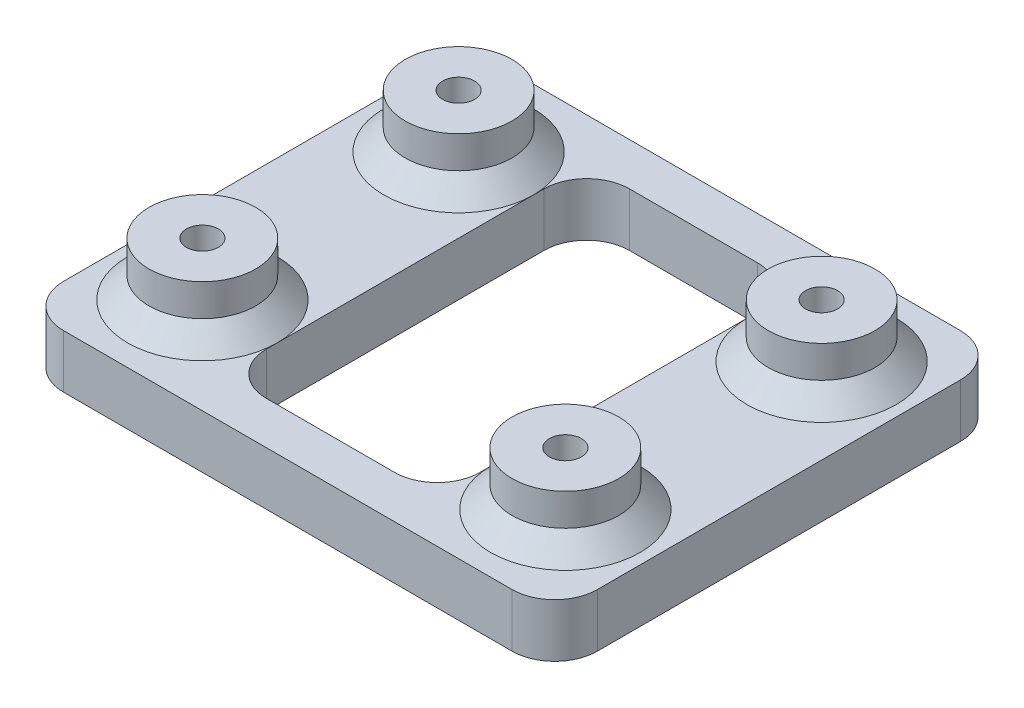
from build123d import *

# Parameters (mm, degrees)
SKETCH1_W           = 31.75
SKETCH1_H           = 26.67
BOSS_EXTRUDE1_DEPTH = 3.175
SKETCH2_R           = 0.95
CUT_EXTRUDE1_DEPTH  = 21.974233597
BOSS_EXTRUDE2_START = 3.175
SKETCH3_R           = 3.175
SKETCH3_R_2         = 0.95
BOSS_EXTRUDE2_DEPTH = 3.175
SKETCH4_W           = 12.7
SKETCH4_H           = 21.59
CUT_EXTRUDE2_DEPTH  = 21.974233597
FILLET1_R           = 2.54
CHAMFER1_SIZE       = 1.27


with BuildPart() as part:
    # Sketch1 → Boss-Extrude1 (new body)
    with BuildSketch(Plane(origin=(0, 0, 0), x_dir=(1, 0, 0), z_dir=(0, 1, 0))):
        Rectangle(SKETCH1_W, SKETCH1_H)
    extrude(amount=BOSS_EXTRUDE1_DEPTH)

    # Sketch2 → Cut-Extrude1 (cut, through all)
    with BuildSketch(Plane(origin=(0, 3.175, 0), x_dir=(1, 0, 0), z_dir=(0, 1, 0))):
        with Locations(Location((-10.795, 7.62, 0), (0, 0, 270))):
            Circle(SKETCH2_R)
        with Locations(Location((10.795, 7.62, 0), (0, 0, 270))):
            Circle(SKETCH2_R)
        with Locations(Location((10.795, -7.62, 0), (0, 0, 270))):
            Circle(SKETCH2_R)
        with Locations(Location((-10.795, -7.62, 0), (0, 0, 270))):
            Circle(SKETCH2_R)
    extrude(amount=-CUT_EXTRUDE1_DEPTH, mode=Mode.SUBTRACT)

    # Sketch3 → Boss-Extrude2 (add)
    # profile 1 of 4: a face of its own
    with BuildSketch(Plane(origin=(0, 3.175, 0), x_dir=(1, 0, 0), z_dir=(0, 1, 0)).offset(BOSS_EXTRUDE2_START)):
        with Locations(Location((-10.795, 7.62, 0), (0, 0, 90))):
            Circle(SKETCH3_R)
        with Locations(Location((-10.795, 7.62, 0), (0, 0, 270))):
            Circle(SKETCH3_R_2, mode=Mode.SUBTRACT)
    # profile 2 of 4: a face of its own
    with BuildSketch(Plane(origin=(0, 3.175, 0), x_dir=(1, 0, 0), z_dir=(0, 1, 0)).offset(BOSS_EXTRUDE2_START)):
        with Locations(Location((10.795, 7.62, 0), (0, 0, 90))):
            Circle(SKETCH3_R)
        with Locations(Location((10.795, 7.62, 0), (0, 0, 270))):
            Circle(SKETCH3_R_2, mode=Mode.SUBTRACT)
    # profile 3 of 4: a face of its own
    with BuildSketch(Plane(origin=(0, 3.175, 0), x_dir=(1, 0, 0), z_dir=(0, 1, 0)).offset(BOSS_EXTRUDE2_START)):
        with Locations(Location((10.795, -7.62, 0), (0, 0, 90))):
            Circle(SKETCH3_R)
        with Locations(Location((10.795, -7.62, 0), (0, 0, 270))):
            Circle(SKETCH3_R_2, mode=Mode.SUBTRACT)
    # profile 4 of 4: a face of its own
    with BuildSketch(Plane(origin=(0, 3.175, 0), x_dir=(1, 0, 0), z_dir=(0, 1, 0)).offset(BOSS_EXTRUDE2_START)):
        with Locations(Location((-10.795, -7.62, 0), (0, 0, 90))):
            Circle(SKETCH3_R)
        with Locations(Location((-10.795, -7.62, 0), (0, 0, 270))):
            Circle(SKETCH3_R_2, mode=Mode.SUBTRACT)
    extrude(amount=-BOSS_EXTRUDE2_DEPTH)

    # Sketch4 → Cut-Extrude2 (cut, through all)
    with BuildSketch(Plane(origin=(0, 3.175, 0), x_dir=(1, 0, 0), z_dir=(0, 1, 0))):
        Rectangle(SKETCH4_W, SKETCH4_H)
    extrude(amount=-CUT_EXTRUDE2_DEPTH, mode=Mode.SUBTRACT)

    # Fillet1
    fillet1_edges = [part.edges().sort_by_distance(p)[0] for p in [
        (6.35, 1.5875, -10.795),
        (6.35, 1.5875, 10.795),
        (-6.35, 1.5875, 10.795),
        (-6.35, 1.5875, -10.795),
        (15.875, 1.5875, 13.335),
        (-15.875, 1.5875, 13.335),
        (-15.875, 1.5875, -13.335),
        (15.875, 1.5875, -13.335),
    ]]
    fillet(fillet1_edges, radius=FILLET1_R)

    # Chamfer1
    chamfer1_edges = [part.edges().sort_by_distance(p)[0] for p in [
        (-10.795, 3.175, -4.445),
        (10.795, 3.175, -4.445),
        (10.795, 3.175, 10.795),
        (-10.795, 3.175, 10.795),
    ]]
    chamfer(chamfer1_edges, length=CHAMFER1_SIZE - 0.0001)  # a hair under: the kernel refuses the full size


solid = part.part
